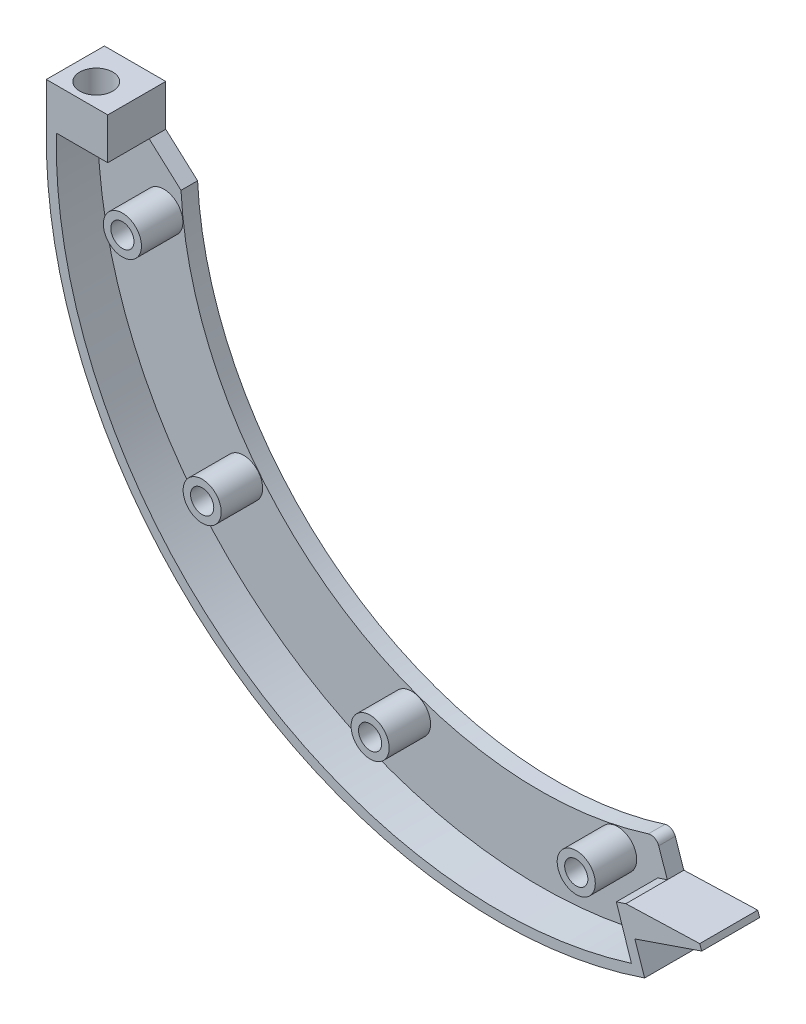
from build123d import *

# Parameters (mm, degrees)
BOSS_EXTRUDE1_DEPTH = 2
BOSS_EXTRUDE2_DEPTH = 5
SKETCH3_R           = 2.3
BOSS_EXTRUDE3_DEPTH = 5
BOSS_EXTRUDE4_DEPTH = 5
SKETCH6_R           = 1.4
CUT_EXTRUDE1_DEPTH  = 5
SKETCH7_R           = 2
CUT_EXTRUDE2_DEPTH  = 8


with BuildPart() as part:
    # Sketch1 → Boss-Extrude1 (new body)
    with BuildSketch(Plane.XY):
        with BuildLine():
            Line((16.887910555, -133.369322594), (14.673679255, -134.127250965))
            Line((14.673679255, -134.127250965), (15.867669408, -137.615404294))
            ThreePointArc((15.867669408, -137.615404294), (-34.007319131, -130.034150274), (-56.342527733, -84.8))
            Line((-56.342527733, -84.8), (-48.940455795, -84.8))
            Line((-48.940455795, -84.8), (-45.096768624, -88.26027792))
            ThreePointArc((-45.096768624, -88.26027792), (-26.483938318, -121.642871269), (11.312186404, -127.325119655))
            ThreePointArc((11.312186404, -127.325119655), (12.064722619, -127.385308804), (12.560733381, -127.954436921))
            Line((12.560733381, -127.954436921), (13.597675192, -130.983785211))
            Line((13.597675192, -130.983785211), (22.508911342, -130.69915726))
            Line((22.508911342, -130.69915726), (22.749464344, -131.362920683))
            Line((22.749464344, -131.362920683), (16.887910555, -133.369322594))
        make_face()
    extrude(amount=BOSS_EXTRUDE1_DEPTH)

    # Sketch2 → Boss-Extrude2 (add)
    with BuildSketch(Plane.XY.offset(2)):
        with BuildLine():
            Line((-56.342527733, -84.8), (-55.142230801, -84.8))
            ThreePointArc((-55.142230801, -84.8), (-55.152352766, -85.399962054), (-55.155726896, -86))
            ThreePointArc((-55.155726896, -86), (-33.342347458, -129.033761126), (14.261826326, -136.880464731))
            Line((14.261826326, -136.880464731), (12.45002618, -131.36047245))
            Line((12.45002618, -131.36047245), (13.597675192, -130.983785211))
            Line((13.597675192, -130.983785211), (15.867669408, -137.615404294))
            ThreePointArc((15.867669408, -137.615404294), (15.540815193, -137.726132378), (15.21326709, -137.834790682))
            ThreePointArc((15.21326709, -137.834790682), (-33.801189066, -130.184178235), (-56.355726896, -86))
            ThreePointArc((-56.355726896, -86), (-56.352427006, -85.399963706), (-56.342527733, -84.8))
        make_face()
    extrude(amount=BOSS_EXTRUDE2_DEPTH)

    # Sketch3 → Boss-Extrude3 (add)
    with BuildSketch(Plane.XY.offset(2)):
        with Locations((7.607262335, -130.722795016)):
            Circle(SKETCH3_R)
        with Locations((-17.271773957, -129.003020951)):
            Circle(SKETCH3_R)
        with Locations((-37.543895432, -114.478381178)):
            Circle(SKETCH3_R)
        with Locations((-47.172740285, -91.473829097)):
            Circle(SKETCH3_R)
        Polygon((14.673679255, -134.127250965), (22.749464344, -131.362920683), (22.508911342, -130.69915726), (13.597675192, -130.983785211), align=None)
    extrude(amount=BOSS_EXTRUDE3_DEPTH)

    # Sketch4 → Boss-Extrude4 (add)
    with BuildSketch(Plane(origin=(0, -84.8, 0), x_dir=(1, 0, 0), z_dir=(0, 1, 0))):
        Polygon((-56.342527733, 0), (-48.940455795, 0), (-48.940455795, -7), (-56.355726896, -7), align=None)
    extrude(amount=BOSS_EXTRUDE4_DEPTH)

    # Sketch6 → Cut-Extrude1 (cut)
    with BuildSketch(Plane.XY.offset(7)):
        with Locations((-47.172740285, -91.473829097)):
            Circle(SKETCH6_R)
        with Locations((-37.543895432, -114.478381178)):
            Circle(SKETCH6_R)
        with Locations((-17.271773957, -129.003020951)):
            Circle(SKETCH6_R)
        with Locations((7.607262335, -130.722795016)):
            Circle(SKETCH6_R)
    extrude(amount=-CUT_EXTRUDE1_DEPTH, mode=Mode.SUBTRACT)

    # Sketch7 → Cut-Extrude2 (cut)
    with BuildSketch(Plane(origin=(0, -79.8, 0), x_dir=(1, 0, 0), z_dir=(0, 1, 0))):
        with Locations((-53.113278602, -4.212750817)):
            Circle(SKETCH7_R)
    extrude(amount=-CUT_EXTRUDE2_DEPTH, mode=Mode.SUBTRACT)


solid = part.part
